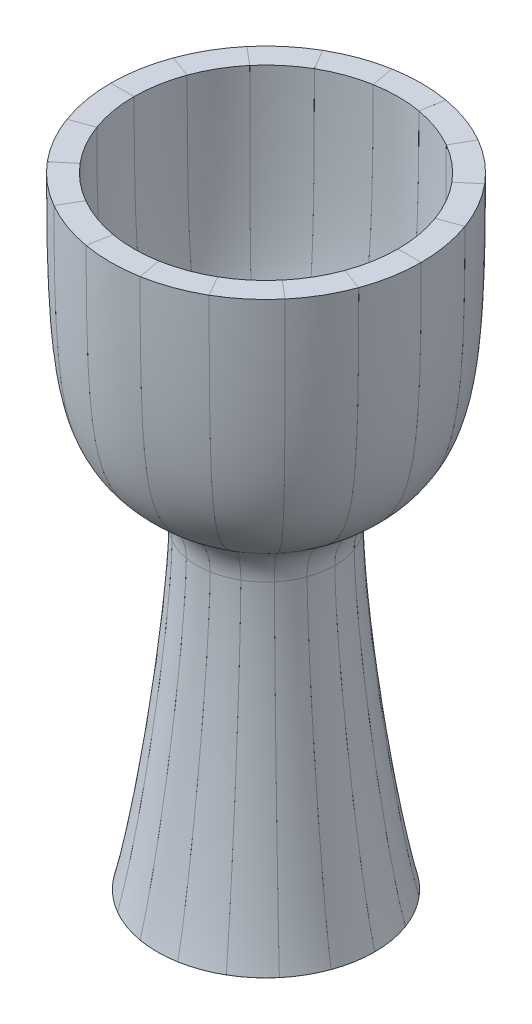
from build123d import *

# Parameters (mm, degrees)
CUT_EXTRUDE1_DEPTH = 543.742947918


with BuildPart() as part:
    # Sketch1 → Revolve1 (revolve)
    with BuildSketch(Plane.XY):
        with BuildLine():
            Line((88.8992134, 0.373974439), (70.34785284, -4.163879202))
            Line((70.34785284, -4.163879202), (70.423907701, -4.142901026))
            add(Edge.make_bspline(
                [(37.200666446, 257.595727133), (37.208715996, 256.818509532), (37.229695774, 255.29252549), (37.295369502, 252.013703702), (37.421712507, 247.636628032), (37.649227429, 241.869271414), (37.957052842, 235.585902091), (38.349473877, 228.775462086), (38.990342923, 218.994106403), (40.019977726, 205.468583515), (41.633732757, 187.32734306), (43.617796275, 167.595293603), (45.941359384, 146.730426369), (48.550680111, 125.299679287), (51.372827093, 103.92822445), (54.322558565, 83.237646387), (57.311079817, 63.784629399), (60.255010933, 46.011635213), (62.612170664, 32.851567984), (64.414133756, 23.387564294), (65.719379706, 16.825097069), (66.974781672, 10.797121978), (68.160889123, 5.374357476), (69.007814084, 1.695222432), (69.568914989, -0.662689275), (69.956209447, -2.264589834), (70.239727307, -3.410153324), (70.423907701, -4.142901026)],
                knots=[0, 0, 0, 0, 0.015625, 0.03125, 0.0625, 0.09375, 0.125, 0.15625, 0.1875, 0.25, 0.3125, 0.375, 0.4375, 0.5, 0.5625, 0.625, 0.6875, 0.75, 0.8125, 0.84375, 0.875, 0.90625, 0.9375, 0.967318545, 0.975131045, 0.984375, 1, 1, 1, 1], degree=3))
            ThreePointArc((37.200666446, 257.595727133), (43.481658516, 284.240965881), (61.433962728, 304.908195565))
            add(Edge.make_bspline(
                [(107.950000614, 507.995162915), (107.950221259, 507.126193822), (107.950112224, 505.376313277), (107.9477017, 501.972090428), (107.940677702, 497.825617407), (107.926074688, 493.034484254), (107.898676125, 486.87222115), (107.850095707, 479.573663117), (107.770360545, 471.396449052), (107.670450581, 463.744487558), (107.511763922, 454.177008649), (107.267998913, 443.298428908), (106.908619716, 431.685560106), (106.486435951, 421.289774872), (106.004284243, 411.93070301), (105.283886992, 400.64169119), (104.241028126, 388.454716594), (102.7638224, 376.187538672), (101.055876092, 365.778280098), (99.10671342, 356.854981536), (96.897873271, 349.124308246), (94.394396766, 342.32867824), (91.526225789, 336.212620105), (88.155675166, 330.498997194), (84.724579232, 325.818329194), (81.404113434, 321.95795857), (78.555377078, 318.961546406), (75.265656458, 315.818652987), (72.072459826, 313.036535557), (69.182957102, 310.684075095), (66.830735909, 308.849110151), (64.693724259, 307.250028321), (62.877308032, 305.931677782), (61.911858354, 305.244862529), (61.433962728, 304.908195565)],
                knots=[0, 0, 0, 0, 0.00390625, 0.0078125, 0.015625, 0.0234375, 0.03125, 0.046875, 0.0625, 0.078125, 0.09375, 0.125, 0.15625, 0.1875, 0.21875, 0.25, 0.3125, 0.375, 0.4375, 0.5, 0.5625, 0.625, 0.6875, 0.75, 0.8125, 0.84375, 0.875, 0.90625, 0.9375, 0.953125, 0.96875, 0.984375, 0.9921875, 1, 1, 1, 1], degree=3))
            Line((107.950000614, 507.995162915), (127, 508))
            add(Edge.make_bspline(
                [(127, 508), (127.04574848, 327.827743271), (72.405175684, 289.334660762)],
                knots=[0, 0, 0, 1, 1, 1], degree=2, weights=[1, 1.878324791, 1]))
            ThreePointArc((72.405175684, 289.334660762), (60.436972876, 275.556507639), (56.249644829, 257.79301514))
            add(Edge.make_bspline(
                [(56.249644829, 257.79301514), (57.625796014, 124.919889374), (88.8992134, 0.500974439)],
                knots=[0, 0, 0, 1, 1, 1], degree=2, weights=[1, 0.516272539, 1]))
            Line((88.8992134, 0.500974439), (88.8992134, 0.373974439))
        make_face()
    revolve(axis=Axis((0, 0, 0), (0, 1, 0)))

    # Sketch2 → Cut-Extrude1 (cut, through all)
    with BuildSketch(Plane(origin=(0, 508, 0), x_dir=(1, 0, 0), z_dir=(0, 1, 0))):
        Polygon((-18.973149737, 0), (-18.973149567, 0.00254), (-323.773148884, 0.022942306), (-323.773149054, 0.020402306), align=None)
        Polygon((-17.828928801, 6.489199392), (-304.240260975, 110.756110741), (-304.239392085, 110.758497502), (-17.82805991, 6.491586154), align=None)
        Polygon((-14.534275925, 12.195705568), (-248.011507315, 208.132997634), (-248.009874504, 208.134943278), (-14.532643114, 12.197651211), align=None)
        Polygon((-9.486574869, 16.431229662), (-161.868905612, 280.405973297), (-161.866705823, 280.40724315), (-9.484375079, 16.432499515), align=None)
        Polygon((-3.294652876, 18.68490496), (-56.202524962, 318.857850229), (-56.200023521, 318.858291128), (-3.292151435, 18.685345859), align=None)
        Polygon((3.294652876, 18.68490496), (56.24270966, 318.850764583), (56.245211042, 318.850323349), (3.297154259, 18.684463726), align=None)
        Polygon((9.486574869, 16.431229662), (161.904243442, 280.385570992), (161.906443062, 280.384300844), (9.488774488, 16.429959515), align=None)
        Polygon((14.534275925, 12.195705568), (248.037736014, 208.101739488), (248.039368564, 208.099793626), (14.535908475, 12.193759706), align=None)
        Polygon((17.828928801, 6.489199392), (304.254216974, 110.717766948), (304.255085546, 110.715380071), (17.829797372, 6.486812515), align=None)
        Polygon((18.973149737, 0), (323.773149054, -0.020402306), (323.773148884, -0.022942306), (18.973149567, -0.00254), align=None)
        Polygon((17.828928801, -6.489199392), (304.240260975, -110.756110741), (304.239392085, -110.758497502), (17.82805991, -6.491586154), align=None)
        Polygon((14.534275925, -12.195705568), (248.011507315, -208.132997634), (248.009874504, -208.134943278), (14.532643114, -12.197651211), align=None)
        Polygon((9.486574869, -16.431229662), (161.868905612, -280.405973297), (161.866705823, -280.40724315), (9.484375079, -16.432499515), align=None)
        Polygon((3.294652876, -18.68490496), (56.202524962, -318.857850229), (56.200023521, -318.858291128), (3.292151435, -18.685345859), align=None)
        Polygon((-3.294652876, -18.68490496), (-56.24270966, -318.850764583), (-56.245211042, -318.850323349), (-3.297154259, -18.684463726), align=None)
        Polygon((-9.486574869, -16.431229662), (-161.904243442, -280.385570992), (-161.906443062, -280.384300844), (-9.488774488, -16.429959515), align=None)
        Polygon((-14.534275925, -12.195705568), (-248.037736014, -208.101739488), (-248.039368564, -208.099793626), (-14.535908475, -12.193759706), align=None)
        Polygon((-17.828928801, -6.489199392), (-304.254216974, -110.717766948), (-304.255085546, -110.715380071), (-17.829797372, -6.486812515), align=None)
    extrude(amount=-CUT_EXTRUDE1_DEPTH, mode=Mode.SUBTRACT)


solid = part.part
